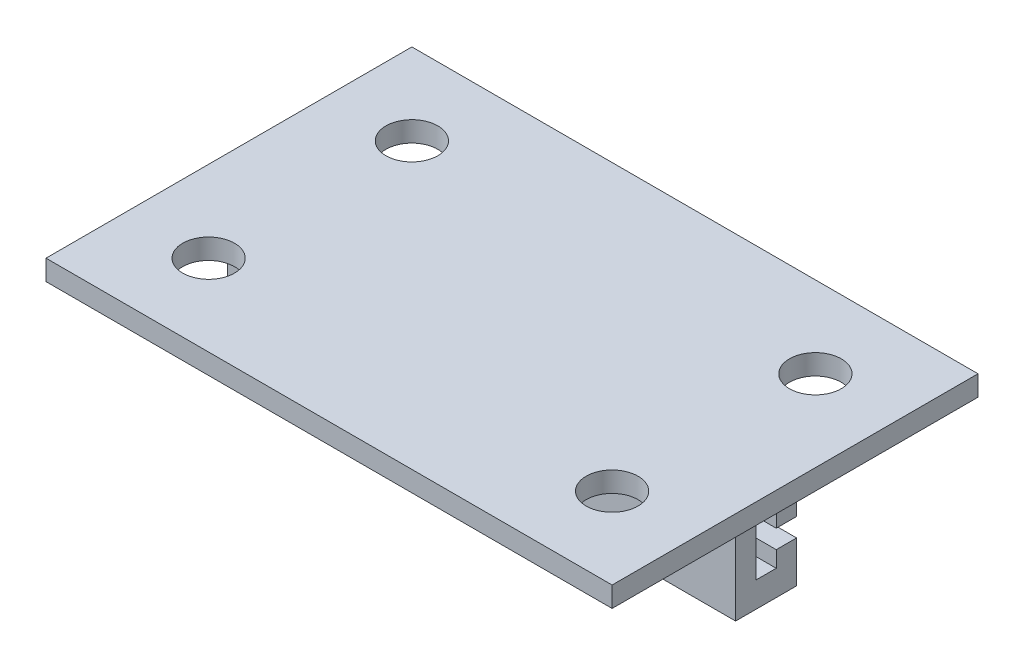
from build123d import *

# Parameters (mm, degrees)
BOSS_EXTRUDE1_DEPTH = 50
SKETCH2_W           = 55.7
SKETCH2_H           = 36
SKETCH2_R           = 2.55
BOSS_EXTRUDE2_DEPTH = 2


with BuildPart() as part:
    # Sketch1 → Boss-Extrude1 (new body)
    with BuildSketch(Plane(origin=(0, 0, 0), x_dir=(0, 0, -1), z_dir=(1, 0, 0))):
        Polygon((0, 10), (0, 0), (6, 0), (6, 4.0875), (4, 4.0875), (4, 2.5), (2, 2.5), (2, 7.5), (4, 7.5), (4, 5.9125), (6, 5.9125), (6, 10), align=None)
    extrude(amount=BOSS_EXTRUDE1_DEPTH)

    # Sketch2 → Boss-Extrude2 (add)
    with BuildSketch(Plane(origin=(0, 10, 0), x_dir=(1, 0, 0), z_dir=(0, 1, 0))):
        with Locations((25, 3)):
            Rectangle(SKETCH2_W, SKETCH2_H)
        with Locations((5.15, 13)):
            Circle(SKETCH2_R, mode=Mode.SUBTRACT)
        with Locations((44.85, 13)):
            Circle(SKETCH2_R, mode=Mode.SUBTRACT)
        with Locations((44.85, -7)):
            Circle(SKETCH2_R, mode=Mode.SUBTRACT)
        with Locations((5.15, -7)):
            Circle(SKETCH2_R, mode=Mode.SUBTRACT)
    extrude(amount=BOSS_EXTRUDE2_DEPTH)


solid = part.part
